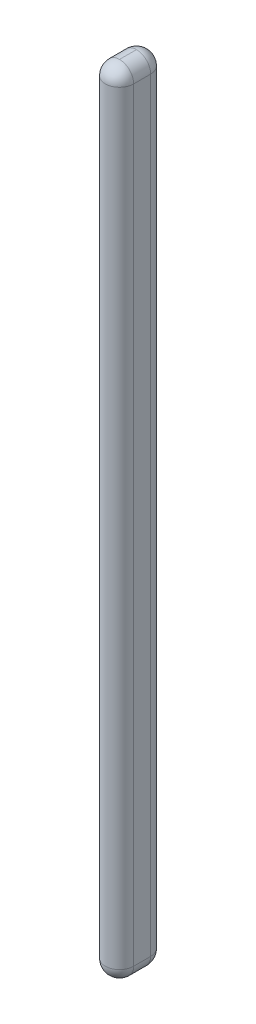
from build123d import *

# Parameters (mm, degrees)
BOSS_EXTRUDE1_DEPTH = 350
FILLET1_R           = 12.5


with BuildPart() as part:
    # Sketch2 → Boss-Extrude1 (new, symmetric)
    with BuildSketch(Plane(origin=(0, 0, 0), x_dir=(-1, 0, 0), z_dir=(0, 1, 0))):
        with BuildLine():
            Line((12.5, 7.5), (12.5, -7.5))
            ThreePointArc((12.5, -7.5), (0, -20), (-12.5, -7.5))
            Line((-12.5, -7.5), (-12.5, 7.5))
            ThreePointArc((-12.5, 7.5), (0, 20), (12.5, 7.5))
        make_face()
    extrude(amount=BOSS_EXTRUDE1_DEPTH, both=True)

    # Fillet1
    fillet1_edges = [part.edges().sort_by_distance(p)[0] for p in [
        (0, 350, -20),
        (-12.5, 350, 0),
        (0, 350, 20),
        (-12.5, -350, 0),
        (0, -350, -20),
        (12.5, -350, 0),
        (0, -350, 20),
        (12.5, 350, 0),
    ]]
    fillet(fillet1_edges, radius=FILLET1_R - 0.0001)  # a hair under: the kernel refuses the full size


solid = part.part
